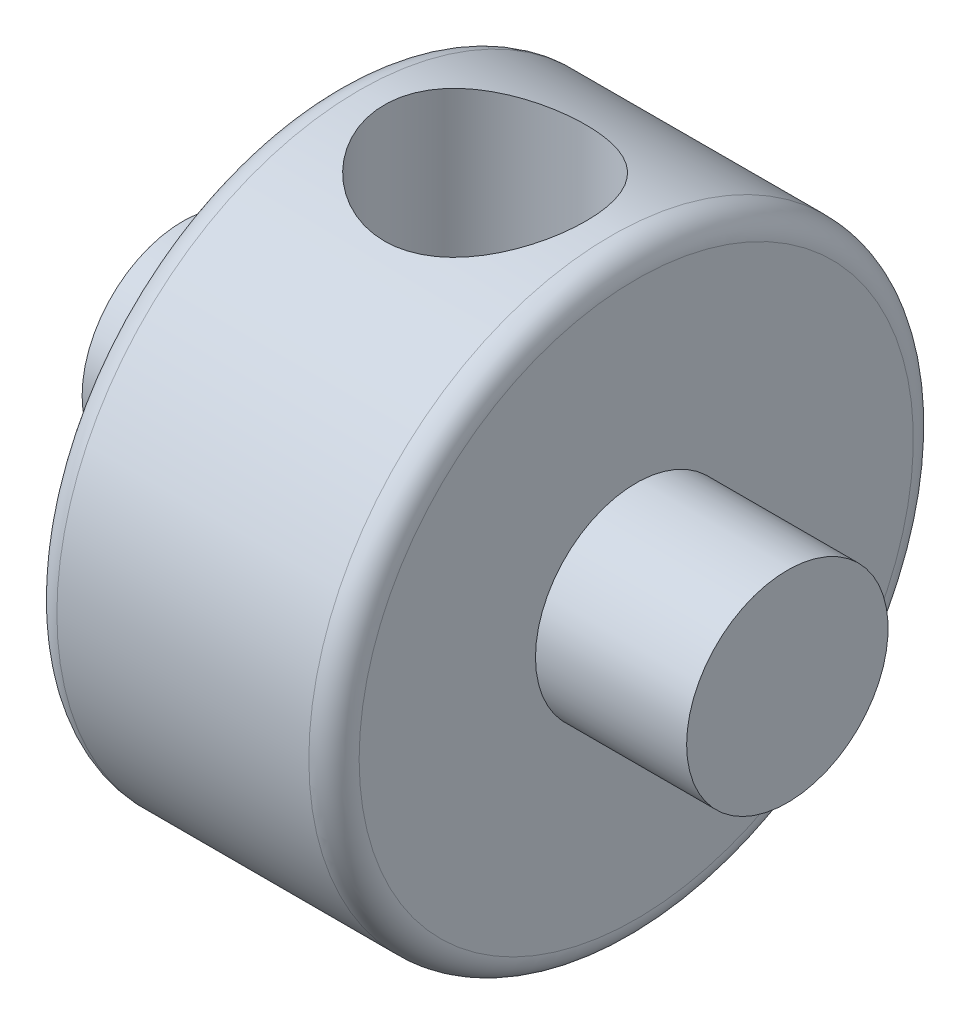
from build123d import *

# Parameters (mm, degrees)
FILLET1_R                    = 0.79248
F_97_0_0059_DIAMETER_HOLE1_D = 6.35


with BuildPart() as part:
    # Sketch1 → Revolve1 (revolve)
    with BuildSketch(Plane.XY):
        Polygon((-9.525, 0), (-9.525, 3.175), (-4.7625, 3.175), (-4.7625, 9.525), (4.7625, 9.525), (4.7625, 3.175), (9.525, 3.175), (9.525, 0), align=None)
    revolve(axis=Axis((-58.389715759, 0, 0), (1, 0, 0)))

    # Fillet1
    fillet1_edges = [part.edges().sort_by_distance(p)[0] for p in [
        (-4.7625, -9.525, 0),
        (4.7625, -9.525, 0),
    ]]
    fillet(fillet1_edges, radius=FILLET1_R)

    # #97 (0.0059) Diameter Hole1 (through all)
    with Locations(Plane.ZX.offset(9.525)):
        with Locations((0, 0)):
            Hole(F_97_0_0059_DIAMETER_HOLE1_D / 2)


solid = part.part
